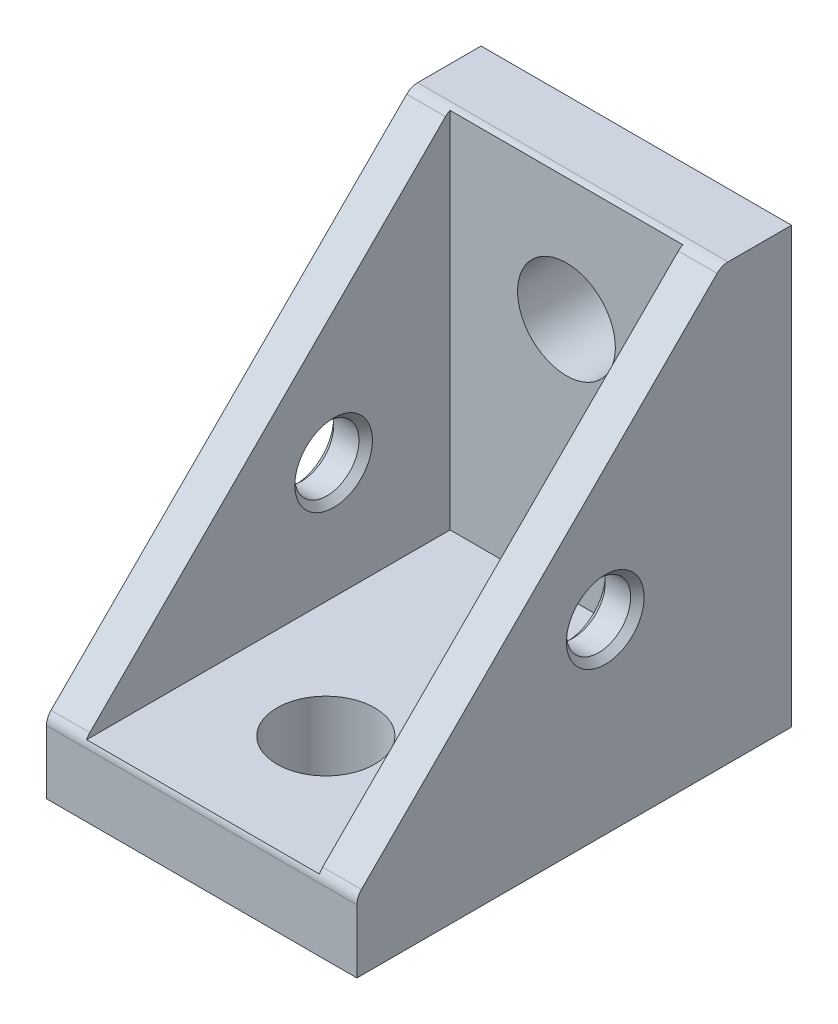
from build123d import *

# Parameters (mm, degrees)
BOSS_EXTRUDE1_DEPTH        = 2.5
SKETCH2_W                  = 15
SKETCH2_H                  = 23.5
BOSS_EXTRUDE2_DEPTH        = 23.5
SKETCH3_W                  = 17.5
SKETCH3_H                  = 23.5
BOSS_EXTRUDE3_DEPTH        = 4.5
SKETCH4_W                  = 17.5
SKETCH4_H                  = 28
BOSS_EXTRUDE4_DEPTH        = 4.5
SKETCH5_W                  = 15
SKETCH5_H                  = 23.5
CUT_EXTRUDE1_DEPTH         = 23.5
BOSS_EXTRUDE5_DEPTH        = 2.5
M3_5_CLEARANCE_HOLE1_D     = 4.134
M3_5_CLEARANCE_HOLE1_DEPTH = 2.5
F_6_3_6_3_DIAMETER_HOLE1_D = 6.3
F_6_3_6_3_DIAMETER_HOLE2_D = 6.3
M3_5_CLEARANCE_HOLE2_D     = 4.134
M3_5_CLEARANCE_HOLE2_DEPTH = 20
CHAMFER1_SIZE              = 0.433
FILLET2_START              = -11
FILLET2_DEPTH              = 22


with BuildPart() as part:
    # Sketch1 → Boss-Extrude1 (new body)
    with BuildSketch(Plane(origin=(-10, 0, 0), x_dir=(0, -1, 0), z_dir=(-1, 0, 0))):
        with BuildLine():
            Line((-27.707106781, 4.792893219), (-28, 4.5))
            Line((-28, 4.5), (-4.5, 4.5))
            Line((-4.5, 4.5), (-4.5, 28))
            Line((-4.5, 28), (-4.792893219, 27.707106781))
            add(Edge.make_bspline(
                [(-4.792893219, 27.707106781), (-12.430964406, 20.069035594), (-20.069035594, 12.430964406), (-27.707106781, 4.792893219)],
                knots=[0, 0, 0, 0, 1, 1, 1, 1], degree=3))
        make_face()
    extrude(amount=-BOSS_EXTRUDE1_DEPTH)

    # Sketch2 → Boss-Extrude2 (add)
    with BuildSketch(Plane.XZ.offset(-4.5)):
        with Locations((0, 16.25)):
            Rectangle(SKETCH2_W, SKETCH2_H)
    extrude(amount=-BOSS_EXTRUDE2_DEPTH)

    # Sketch3 → Boss-Extrude3 (add)
    with BuildSketch(Plane(origin=(0, 0, 4.5), x_dir=(-1, 0, 0), z_dir=(0, 0, -1))):
        with Locations((1.25, 16.25)):
            Rectangle(SKETCH3_W, SKETCH3_H)
    extrude(amount=BOSS_EXTRUDE3_DEPTH)

    # Sketch4 → Boss-Extrude4 (add)
    with BuildSketch(Plane.XZ.offset(-4.5)):
        with Locations((-1.25, 14)):
            Rectangle(SKETCH4_W, SKETCH4_H)
    extrude(amount=BOSS_EXTRUDE4_DEPTH)

    # Sketch5 → Cut-Extrude1 (cut)
    with BuildSketch(Plane(origin=(0, 28, 0), x_dir=(-1, 0, 0), z_dir=(0, 1, 0))):
        with Locations((0, 16.25)):
            Rectangle(SKETCH5_W, SKETCH5_H)
    extrude(amount=-CUT_EXTRUDE1_DEPTH, mode=Mode.SUBTRACT)

    # Sketch6 → Boss-Extrude5 (add)
    with BuildSketch(Plane(origin=(7.5, 0, 0), x_dir=(0, 0, -1), z_dir=(1, 0, 0))):
        with BuildLine():
            Line((-28, 0), (-28, 4.5))
            Line((-28, 4.5), (-27.707106781, 4.792893219))
            add(Edge.make_bspline(
                [(-4.792893219, 27.707106781), (-12.430964406, 20.069035594), (-20.069035594, 12.430964406), (-27.707106781, 4.792893219)],
                knots=[0, 0, 0, 0, 1, 1, 1, 1], degree=3))
            Line((-4.792893219, 27.707106781), (-4.5, 28))
            Line((-4.5, 28), (0, 28))
            Line((0, 28), (0, 0))
            Line((0, 0), (-28, 0))
        make_face()
    extrude(amount=BOSS_EXTRUDE5_DEPTH)

    # M3.5 Clearance Hole1
    with Locations(Plane.ZY.offset(-7.5)):
        with Locations((12, 12)):
            Hole(M3_5_CLEARANCE_HOLE1_D / 2, depth=M3_5_CLEARANCE_HOLE1_DEPTH)

    # Ø6.3 (6.3) Diameter Hole1 (through all)
    with Locations(Plane(origin=(0, 4.5, 0), x_dir=(1, 0, 0), z_dir=(0, 1, 0))):
        with Locations((0, -20)):
            Hole(F_6_3_6_3_DIAMETER_HOLE1_D / 2)

    # Ø6.3 (6.3) Diameter Hole2 (through all)
    with Locations(Plane.XY.offset(4.5)):
        with Locations((0, 20)):
            Hole(F_6_3_6_3_DIAMETER_HOLE2_D / 2)

    # M3.5 Clearance Hole2
    with Locations(Plane.ZY.offset(10)):
        with Locations((12, 12)):
            Hole(M3_5_CLEARANCE_HOLE2_D / 2, depth=M3_5_CLEARANCE_HOLE2_DEPTH)

    # Chamfer1
    chamfer1_edges = [part.edges().sort_by_distance(p)[0] for p in [
        (-7.5, 12, 14.067),
        (-10, 12, 14.067),
        (7.5, 12, 14.067),
        (10, 12, 14.067),
    ]]
    chamfer(chamfer1_edges, length=CHAMFER1_SIZE)

    # Fillet2: read off the stored shape, not the designer's step
    # Fillet2 outline → Fillet2 (cut)
    with BuildSketch(Plane.YZ.offset(FILLET2_START)):
        with BuildLine():
            Line((4.5, 28), (4.085786438, 28))
            ThreePointArc((4.085786438, 28), (4.46846987, 27.923879533), (4.792893219, 27.707106781))
            Line((4.792893219, 27.707106781), (4.5, 28))
        make_face()
        with BuildLine():
            Line((28, 4.5), (27.707106781, 4.792893219))
            ThreePointArc((27.707106781, 4.792893219), (27.923879533, 4.46846987), (28, 4.085786438))
            Line((28, 4.085786438), (28, 4.5))
        make_face()
    extrude(amount=FILLET2_DEPTH, mode=Mode.SUBTRACT)


solid = part.part
